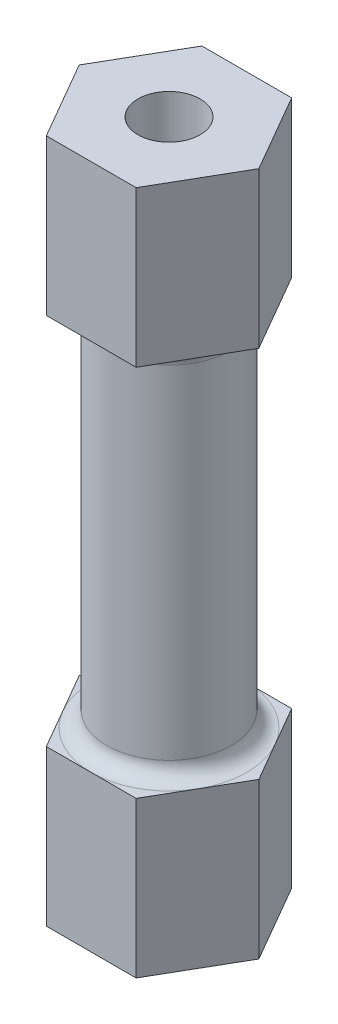
from build123d import *

# Parameters (mm, degrees)
BOSS_EXTRUDE1_DEPTH = 5
SKETCH2_R           = 2
BOSS_EXTRUDE2_DEPTH = 12
BOSS_EXTRUDE3_DEPTH = 5
FILLET3_R           = 0.5
SKETCH4_R           = 1
CUT_EXTRUDE1_DEPTH  = 23.328979675


with BuildPart() as part:
    # Sketch1 → Boss-Extrude1 (new body)
    with BuildSketch(Plane(origin=(0, 0, 0), x_dir=(1, 0, 0), z_dir=(0, 1, 0))):
        Polygon((2.886751346, 0), (1.443375673, 2.5), (-1.443375673, 2.5), (-2.886751346, 0), (-1.443375673, -2.5), (1.443375673, -2.5), align=None)
    extrude(amount=BOSS_EXTRUDE1_DEPTH)

    # Sketch2 → Boss-Extrude2 (add)
    with BuildSketch(Plane(origin=(0, 5, 0), x_dir=(1, 0, 0), z_dir=(0, 1, 0))):
        with Locations(Location((0, 0, 0), (0, 0, 270))):
            Circle(SKETCH2_R)
    extrude(amount=BOSS_EXTRUDE2_DEPTH)

    # Sketch3 → Boss-Extrude3 (add)
    with BuildSketch(Plane(origin=(0, 17, 0), x_dir=(1, 0, 0), z_dir=(0, 1, 0))):
        Polygon((2.886751346, 0), (1.443375673, 2.5), (-1.443375673, 2.5), (-2.886751346, 0), (-1.443375673, -2.5), (1.443375673, -2.5), align=None)
    extrude(amount=BOSS_EXTRUDE3_DEPTH)

    # Fillet3
    fillet3_edges = [part.edges().sort_by_distance(p)[0] for p in [
        (0, 5, -2),
        (0, 17, -2),
    ]]
    fillet(fillet3_edges, radius=FILLET3_R - 0.0001)  # a hair under: the kernel refuses the full size

    # Sketch4 → Cut-Extrude1 (cut, through all)
    with BuildSketch(Plane.XZ):
        with Locations(Location((0, 0, 0), (0, 0, 270))):
            Circle(SKETCH4_R)
    extrude(amount=-CUT_EXTRUDE1_DEPTH, mode=Mode.SUBTRACT)


solid = part.part
